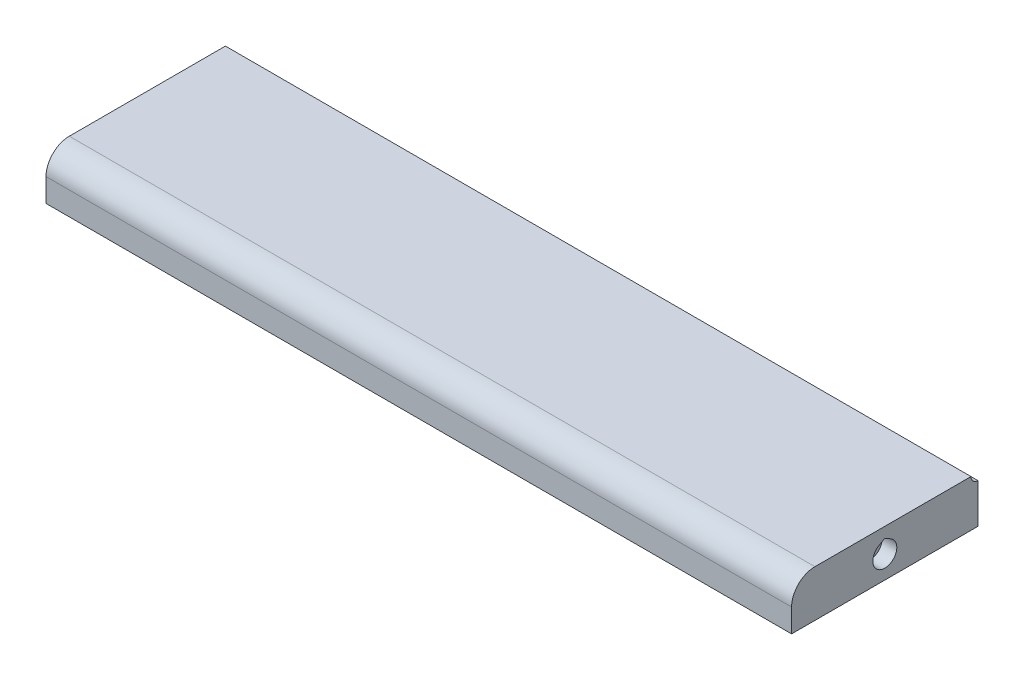
from build123d import *

# Parameters (mm, degrees)
SKETCH_1_W               = 160
SKETCH_1_H               = 40
EXTRUDE_1_DEPTH          = 10
SWEEP_START              = -80
SWEEP_1_DEPTH            = 160
SKETCH_6_R               = 2.575
CUT_EXTRUDE_1_DEPTH      = 3.15
FILLET_1_R               = 5
SKETCH_7_R               = 2.575
CUT_EXTRUDE_2_DEPTH      = 3.15
PATTERN_CIRCULAR_1_COUNT = 2


# Read off the part's stored shape, not the designer's step: Вырез-По траектории1
with BuildPart() as part:
    # Эскиз1 → Бобышка-Вытянуть1 (new body)
    with BuildSketch(Plane(origin=(0, 0, 0), x_dir=(1, 0, 0), z_dir=(0, 1, 0))):
        Rectangle(SKETCH_1_W, SKETCH_1_H)
    extrude(amount=-EXTRUDE_1_DEPTH)

    # Вырез-По траектории1 outline → Вырез-По траектории1 (cut)
    with BuildSketch(Plane.YZ.offset(SWEEP_START)):
        with BuildLine():
            ThreePointArc((0, -18.5), (-1.060660172, -18.939339828), (-1.5, -20))
            Line((-1.5, -20), (0, -20))
            Line((0, -20), (0, -18.5))
        make_face()
    extrude(amount=SWEEP_1_DEPTH, mode=Mode.SUBTRACT)

    # Эскиз6 → Вырез-Вытянуть1 (cut)
    with BuildSketch(Plane(origin=(0, 0, -20), x_dir=(-1, 0, 0), z_dir=(0, 0, -1))):
        with Locations((-40, -5.949176943)):
            Circle(SKETCH_6_R)
        with BuildLine():
            Line((-40, -2.975823057), (-41.2875, -3.719161528))
            ThreePointArc((-41.2875, -3.719161528), (-40, -3.374176943), (-38.7125, -3.719161528))
            Line((-38.7125, -3.719161528), (-40, -2.975823057))
        make_face()
        with Locations((40, -5.949176943)):
            Circle(SKETCH_6_R)
        with BuildLine():
            ThreePointArc((38.7125, -3.719161528), (40, -3.374176943), (41.2875, -3.719161528))
            Line((41.2875, -3.719161528), (40, -2.975823057))
            Line((40, -2.975823057), (38.7125, -3.719161528))
        make_face()
    extrude(amount=-CUT_EXTRUDE_1_DEPTH, mode=Mode.SUBTRACT)

    # Скругление1
    fillet_1_edges = [part.edges().sort_by_distance(p)[0] for p in [
        (0, 0, 20),
    ]]
    fillet(fillet_1_edges, radius=FILLET_1_R)

    # Эскиз7 → Вырез-Вытянуть2 (cut)
    with BuildSketch(Plane.ZY.offset(80)):
        with Locations((0, -5.199176943)):
            Circle(SKETCH_7_R)
        with BuildLine():
            Line((1.2875, -2.969161528), (0, -2.225823057))
            Line((0, -2.225823057), (-1.2875, -2.969161528))
            ThreePointArc((-1.2875, -2.969161528), (0, -2.624176943), (1.2875, -2.969161528))
        make_face()
    cut_extrude_2 = extrude(amount=-CUT_EXTRUDE_2_DEPTH, mode=Mode.SUBTRACT)

    # Круговой массив1: Вырез-Вытянуть2 ×2 about axis
    pattern_circular_1_axis = Axis((0, 0, 0), (0, 1, 0))
    for i in range(1, PATTERN_CIRCULAR_1_COUNT):
        add(cut_extrude_2.rotate(pattern_circular_1_axis, i * 360 / PATTERN_CIRCULAR_1_COUNT), mode=Mode.SUBTRACT)


solid = part.part
